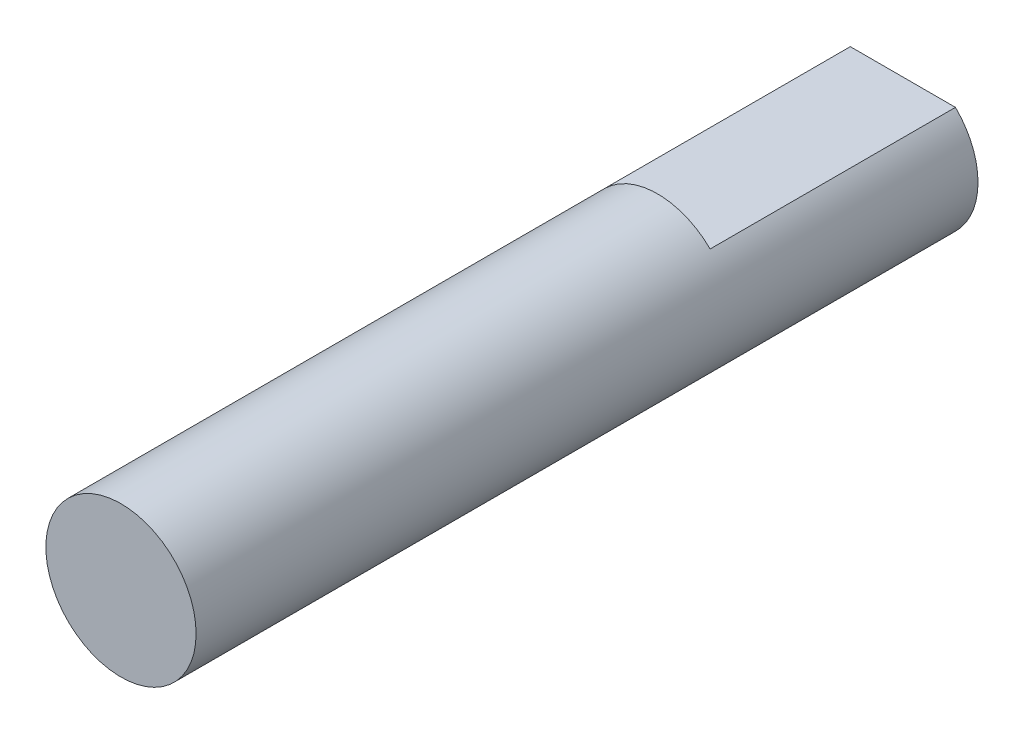
from build123d import *

# Parameters (mm, degrees)
SALIENTE_EXTRUIR1_DEPTH      = 18.75
SALIENTE_EXTRUIR1_DEPTH_BACK = 18.75
CROQUIS1_R                   = 2.45
CROQUIS3_R                   = 1
CORTAR_EXTRUIR1_DEPTH        = 8
SZKIC2_W                     = 5
SZKIC2_H                     = 5
WYTNIJ_WYCI_GNI_CIE1_DEPTH   = 12


with BuildPart() as part:
    # Croquis1 → Saliente-Extruir1 (new, two sides: drawn at the far end of the back side and taken through both)
    with BuildSketch(Plane.XY.offset(-SALIENTE_EXTRUIR1_DEPTH_BACK)):
        Circle(CROQUIS1_R)
    extrude(amount=SALIENTE_EXTRUIR1_DEPTH + SALIENTE_EXTRUIR1_DEPTH_BACK)

    # Croquis3 → Cortar-Extruir1 (cut)
    with BuildSketch(Plane.XY.offset(18.75)):
        Circle(CROQUIS3_R)
        with BuildLine():
            Line((-1.71464282, 1.75), (1.71464282, 1.75))
            ThreePointArc((1.71464282, 1.75), (0, 2.45), (-1.71464282, 1.75))
        make_face()
        with BuildLine():
            Line((-1.71464282, -1.75), (1.71464282, -1.75))
            ThreePointArc((1.71464282, -1.75), (0, -2.45), (-1.71464282, -1.75))
        make_face()
    cortar_extruir1 = extrude(amount=-CORTAR_EXTRUIR1_DEPTH, mode=Mode.SUBTRACT)

    # Simetría1: Cortar-Extruir1 across plane
    add(cortar_extruir1.mirror(Plane.XY), mode=Mode.SUBTRACT)

    # Szkic2 → Wytnij-wyciągnięcie1 (cut)
    with BuildSketch(Plane.XY.offset(18.75)):
        Rectangle(SZKIC2_W, SZKIC2_H)
    extrude(amount=-WYTNIJ_WYCI_GNI_CIE1_DEPTH, mode=Mode.SUBTRACT)


solid = part.part
